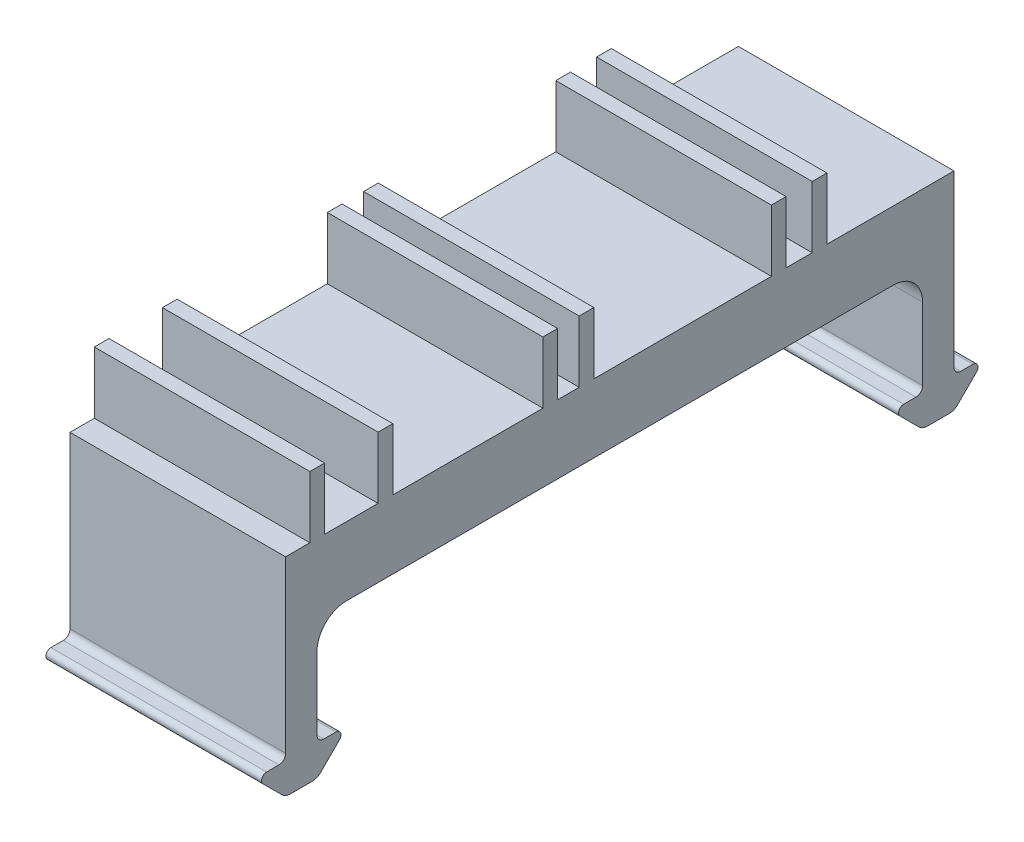
from build123d import *

# Parameters (mm, degrees)
SKETCH1_W               = 55.88
SKETCH1_H               = 69.85
BOSS_EXTRUDE1_DEPTH     = 185.928
CAVITY2_DEPTH           = 55.88
CUT_EXTRUDE1_DEPTH      = 207.326968872
CUT_EXTRUDE1_DEPTH_BACK = 207.326968872
CAVITY3_START           = 155.611951918
CAVITY3_OUTLINE_W       = 55.88
CAVITY3_OUTLINE_H       = 16.002
CAVITY3_DEPTH           = 13.861518057
CAVITY3_START_2         = 43.09882965
CAVITY3_2_OUTLINE_W     = 55.88
CAVITY3_2_OUTLINE_H     = 16.002
CAVITY3_2_DEPTH         = 6.77134799
CAVITY3_START_3         = 103.490840018
CAVITY3_3_OUTLINE_W     = 55.88
CAVITY3_3_OUTLINE_H     = 16.002
CAVITY3_3_DEPTH         = 5.588
CUT_EXTRUDE2_DEPTH      = 207.326968872
CUT_EXTRUDE2_DEPTH_BACK = 207.326968872
SKETCH4_W               = 12.644530025
SKETCH4_H               = 16.002
SKETCH4_W_2             = 38.9131119
SKETCH4_W_3             = 46.000662378
SKETCH4_W_4             = 39.28882965
FILLET1_R               = 7.62


# Read off the part's stored shape, not the designer's step: Cavity2, Cavity3
with BuildPart() as part:
    # Sketch1 → Boss-Extrude1 (new body)
    with BuildSketch(Plane.XY):
        with Locations((27.94, 34.925)):
            Rectangle(SKETCH1_W, SKETCH1_H)
    extrude(amount=BOSS_EXTRUDE1_DEPTH)

    # Cavity2 outline → Cavity2 (cut)
    with BuildSketch(Plane.YZ):
        with BuildLine():
            Line((0, 185.372681959), (0, 178.347013566))
            ThreePointArc((0, 178.347013566), (0.234915375, 179.528012907), (0.903897763, 180.529215804))
            Line((0.903897763, 180.529215804), (5.797646215, 185.422964256))
            ThreePointArc((5.797646215, 185.422964256), (7.204232738, 185.702751711), (8.001, 184.510305235))
            Line((8.001, 184.510305235), (8.001, 181.3052))
            ThreePointArc((8.001, 181.3052), (8.506885168, 180.083885168), (9.7282, 179.578))
            Line((9.7282, 179.578), (10.3378, 179.578))
            ThreePointArc((10.3378, 179.578), (11.559114832, 180.083885168), (12.065, 181.3052))
            Line((12.065, 181.3052), (12.065, 182.478305235))
            ThreePointArc((12.065, 182.478305235), (11.049, 183.494305235), (12.065, 184.510305235))
            Line((12.065, 184.510305235), (12.065, 185.928))
            Line((12.065, 185.928), (0.555318041, 185.928))
            Line((0.555318041, 185.928), (0, 185.372681959))
        make_face()
        with BuildLine():
            Line((0, 160.528), (0, 156.668018354))
            ThreePointArc((0, 156.668018354), (1.097837867, 157.474813069), (2.011305235, 156.464))
            Line((2.011305235, 156.464), (6.738477062, 156.464))
            ThreePointArc((6.738477062, 156.464), (7.643464695, 157.473916954), (8.74621772, 156.684695417))
            ThreePointArc((8.74621772, 156.684695417), (10.673815789, 157.855184211), (11.844304583, 159.78278228))
            ThreePointArc((11.844304583, 159.78278228), (11.055083046, 160.885535305), (12.065, 161.790522938))
            Line((12.065, 161.790522938), (12.065, 166.517694765))
            ThreePointArc((12.065, 166.517694765), (11.049, 167.533694765), (12.065, 168.549694765))
            Line((12.065, 168.549694765), (12.065, 169.7228))
            ThreePointArc((12.065, 169.7228), (11.559114832, 170.944114832), (10.3378, 171.45))
            Line((10.3378, 171.45), (9.7282, 171.45))
            ThreePointArc((9.7282, 171.45), (8.506885168, 170.944114832), (8.001, 169.7228))
            Line((8.001, 169.7228), (8.001, 166.517694765))
            ThreePointArc((8.001, 166.517694765), (7.204232738, 165.325248289), (5.797646215, 165.605035744))
            Line((5.797646215, 165.605035744), (0.903897763, 170.498784196))
            ThreePointArc((0.903897763, 170.498784196), (0.234915375, 171.499987093), (0, 172.680986434))
            Line((0, 172.680986434), (0, 165.655318041))
            Line((0, 165.655318041), (2.923964256, 162.731353785))
            ThreePointArc((2.923964256, 162.731353785), (3.203751711, 161.324767262), (2.011305235, 160.528))
            Line((2.011305235, 160.528), (0, 160.528))
        make_face()
        with BuildLine():
            Line((0, 20.272681959), (0, 13.247013566))
            ThreePointArc((0, 13.247013566), (0.234915375, 14.428012907), (0.903897763, 15.429215804))
            Line((0.903897763, 15.429215804), (5.797646215, 20.322964256))
            ThreePointArc((5.797646215, 20.322964256), (7.204232738, 20.602751711), (8.001, 19.410305235))
            Line((8.001, 19.410305235), (8.001, 16.2052))
            ThreePointArc((8.001, 16.2052), (8.506885168, 14.983885168), (9.7282, 14.478))
            Line((9.7282, 14.478), (10.3378, 14.478))
            ThreePointArc((10.3378, 14.478), (11.559114832, 14.983885168), (12.065, 16.2052))
            Line((12.065, 16.2052), (12.065, 17.378305235))
            ThreePointArc((12.065, 17.378305235), (11.049, 18.394305235), (12.065, 19.410305235))
            Line((12.065, 19.410305235), (12.065, 24.137477062))
            ThreePointArc((12.065, 24.137477062), (11.055083046, 25.042464695), (11.844304583, 26.14521772))
            ThreePointArc((11.844304583, 26.14521772), (10.673815789, 28.072815789), (8.74621772, 29.243304583))
            ThreePointArc((8.74621772, 29.243304583), (7.643464695, 28.454083046), (6.738477062, 29.464))
            Line((6.738477062, 29.464), (2.011305235, 29.464))
            ThreePointArc((2.011305235, 29.464), (1.097837867, 28.453186931), (0, 29.259981646))
            Line((0, 29.259981646), (0, 25.4))
            Line((0, 25.4), (2.011305235, 25.4))
            ThreePointArc((2.011305235, 25.4), (3.203751711, 24.603232738), (2.923964256, 23.196646215))
            Line((2.923964256, 23.196646215), (0, 20.272681959))
        make_face()
        with BuildLine():
            Line((12.065, 0), (12.065, 1.417694765))
            ThreePointArc((12.065, 1.417694765), (11.049, 2.433694765), (12.065, 3.449694765))
            Line((12.065, 3.449694765), (12.065, 4.6228))
            ThreePointArc((12.065, 4.6228), (11.559114832, 5.844114832), (10.3378, 6.35))
            Line((10.3378, 6.35), (9.7282, 6.35))
            ThreePointArc((9.7282, 6.35), (8.506885168, 5.844114832), (8.001, 4.6228))
            Line((8.001, 4.6228), (8.001, 1.417694765))
            ThreePointArc((8.001, 1.417694765), (7.204232738, 0.225248289), (5.797646215, 0.505035744))
            Line((5.797646215, 0.505035744), (0.903897763, 5.398784196))
            ThreePointArc((0.903897763, 5.398784196), (0.234915375, 6.399987093), (0, 7.580986434))
            Line((0, 7.580986434), (0, 0.555318041))
            Line((0, 0.555318041), (0.555318041, 0))
            Line((0.555318041, 0), (12.065, 0))
        make_face()
    extrude(amount=CAVITY2_DEPTH, mode=Mode.SUBTRACT)

    # Sketch2 → Cut-Extrude1 (cut, two sides: drawn at the far end of the back side and taken through both)
    with BuildSketch(Plane(origin=(55.88, 0, 0), x_dir=(0, 0, -1), z_dir=(1, 0, 0)).offset(-CUT_EXTRUDE1_DEPTH_BACK)):
        Polygon((-185.928, 53.848), (-185.928, 12.065), (-187.786827766, 0), (-183.387405269, 0), (-186.368592882, 6.922214935), (-185.928, 7.695543501), (-179.578, 10.033), (-179.578, 53.848), align=None)
        Polygon((-171.45, 36.068), (-171.45, 10.033), (-163.181232022, 10.033), (-165.655318041, 0), (-20.272681959, 0), (-21.714355158, 8.498769389), (-14.478, 10.033), (-14.478, 36.068), align=None)
        Polygon((0.982362905, -0.670371441), (0, 12.065), (0, 53.848), (-6.35, 53.848), (-6.35, 10.033), (-1.572527278, 10.022034637), (0.234962195, 6.712117206), (-3.38001675, -0.670371441), align=None)
    extrude(amount=CUT_EXTRUDE1_DEPTH + CUT_EXTRUDE1_DEPTH_BACK, mode=Mode.SUBTRACT)

    # Cavity3 outline → Cavity3 (cut)
    with BuildSketch(Plane.XY.offset(CAVITY3_START)):
        with Locations((27.94, 61.849)):
            Rectangle(CAVITY3_OUTLINE_W, CAVITY3_OUTLINE_H)
    extrude(amount=CAVITY3_DEPTH, mode=Mode.SUBTRACT)

    # Cavity3 2 outline → Cavity3 2 (cut)
    with BuildSketch(Plane.XY.offset(CAVITY3_START_2)):
        with Locations((27.94, 61.849)):
            Rectangle(CAVITY3_2_OUTLINE_W, CAVITY3_2_OUTLINE_H)
    extrude(amount=CAVITY3_2_DEPTH, mode=Mode.SUBTRACT)

    # Cavity3 3 outline → Cavity3 3 (cut)
    with BuildSketch(Plane.XY.offset(CAVITY3_START_3)):
        with Locations((27.94, 61.849)):
            Rectangle(CAVITY3_3_OUTLINE_W, CAVITY3_3_OUTLINE_H)
    extrude(amount=CAVITY3_3_DEPTH, mode=Mode.SUBTRACT)

    # Sketch4 → Cut-Extrude2 (cut, two sides: drawn at the far end of the back side and taken through both)
    with BuildSketch(Plane(origin=(55.88, 0, 0), x_dir=(0, 0, -1), z_dir=(1, 0, 0)).offset(-CUT_EXTRUDE2_DEPTH_BACK)):
        with Locations((-179.605734987, 61.849)):
            Rectangle(SKETCH4_W, SKETCH4_H)
        with Locations((-132.345395968, 61.849)):
            Rectangle(SKETCH4_W_2, SKETCH4_H)
        with Locations((-76.680508829, 61.849)):
            Rectangle(SKETCH4_W_3, SKETCH4_H)
        with Locations((-19.644414825, 61.849)):
            Rectangle(SKETCH4_W_4, SKETCH4_H)
    extrude(amount=CUT_EXTRUDE2_DEPTH + CUT_EXTRUDE2_DEPTH_BACK, mode=Mode.SUBTRACT)

    # Fillet1
    fillet1_edges = [part.edges().sort_by_distance(p)[0] for p in [
        (27.94, 36.068, 14.478),
        (27.94, 36.068, 171.45),
    ]]
    fillet(fillet1_edges, radius=FILLET1_R)


solid = part.part
